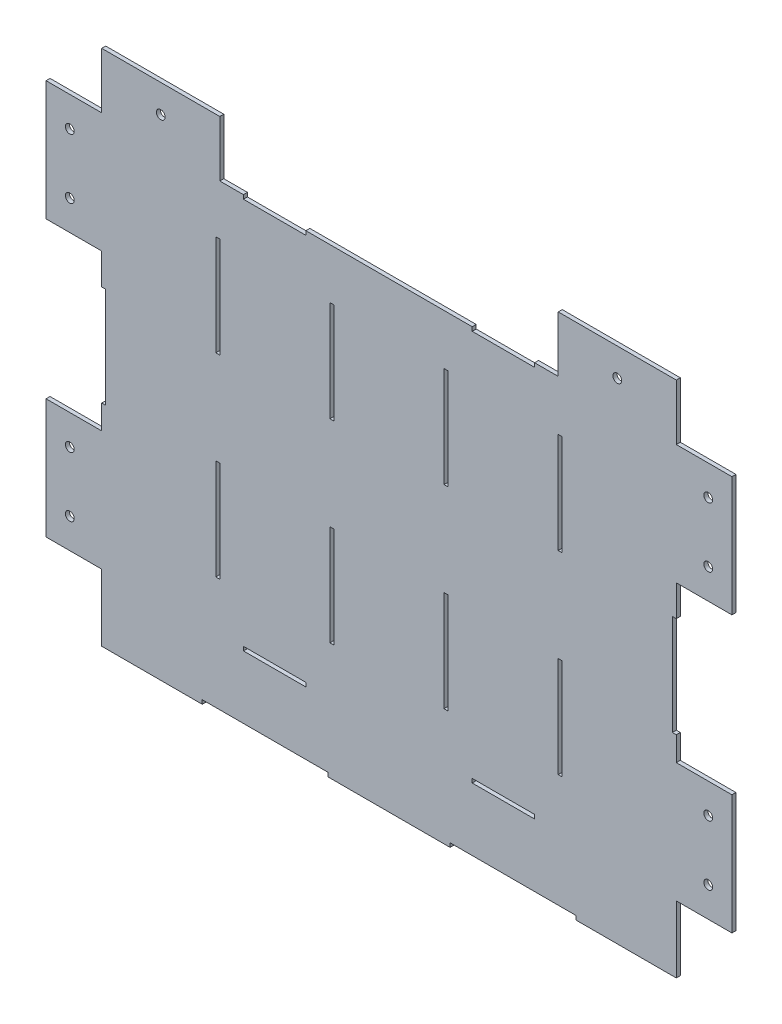
from build123d import *

# Parameters (mm, degrees)
SKETCH1_W                 = 457.223
SKETCH1_H                 = 367.60800004
BOSS_EXTRUDE2_DEPTH       = 3.175
SKETCH4_W                 = 3.175
SKETCH4_H                 = 80
CUT_EXTRUDE1_DEPTH        = 3.175
LPATTERN1_COPY_1_SKETCH_W = 3.175
LPATTERN1_COPY_1_SKETCH_H = 80
LPATTERN1_COPY_1_DEPTH    = 3.175
LPATTERN1_COPY_2_SKETCH_W = 3.175
LPATTERN1_COPY_2_SKETCH_H = 80
LPATTERN1_COPY_2_DEPTH    = 3.175
LPATTERN1_COPY_3_SKETCH_W = 3.175
LPATTERN1_COPY_3_SKETCH_H = 80
LPATTERN1_COPY_3_DEPTH    = 3.175
LPATTERN1_COPY_4_SKETCH_W = 3.175
LPATTERN1_COPY_4_SKETCH_H = 80
LPATTERN1_COPY_4_DEPTH    = 3.175
LPATTERN1_COPY_5_SKETCH_W = 3.175
LPATTERN1_COPY_5_SKETCH_H = 80
LPATTERN1_COPY_5_DEPTH    = 3.175
LPATTERN1_COPY_6_SKETCH_W = 3.175
LPATTERN1_COPY_6_SKETCH_H = 80
LPATTERN1_COPY_6_DEPTH    = 3.175
SKETCH5_W                 = 49.658811606
SKETCH5_H                 = 3.175
CUT_EXTRUDE2_DEPTH        = 3.175
MIRROR3_COPY_1_SKETCH_W   = 49.658811606
MIRROR3_COPY_1_SKETCH_H   = 3.175
MIRROR3_COPY_1_DEPTH      = 3.175
MIRROR3_COPY_2_SKETCH_W   = 49.658811606
MIRROR3_COPY_2_SKETCH_H   = 3.175
MIRROR3_COPY_2_DEPTH      = 3.175
SKETCH6_W                 = 3.175
SKETCH6_H                 = 80
CUT_EXTRUDE3_DEPTH        = 311.705796904
SKETCH7_W                 = 100
SKETCH7_H                 = 3.175
CUT_EXTRUDE4_DEPTH        = 3.175
SKETCH8_W                 = 44.275
SKETCH8_H                 = 95.25
SKETCH8_R                 = 3
SKETCH8_W_2               = 93.98
SKETCH8_H_2               = 44.45
BOSS_EXTRUDE3_DEPTH       = 3.175
M6_CLEARANCE_HOLE1_D      = 7


with BuildPart() as part:
    # Sketch1 → Boss-Extrude2 (new body)
    with BuildSketch(Plane.XY):
        with Locations((0, -26.588)):
            Rectangle(SKETCH1_W, SKETCH1_H)
    extrude(amount=BOSS_EXTRUDE2_DEPTH)

    # Sketch4 → Cut-Extrude1 (cut)
    with BuildSketch(Plane.XY.offset(3.175)):
        with Locations((-136.213, 77.21600002)):
            Rectangle(SKETCH4_W, SKETCH4_H)
    cut_extrude1 = extrude(amount=-CUT_EXTRUDE1_DEPTH, mode=Mode.SUBTRACT)

    # Mirror1: Cut-Extrude1 across plane
    add(cut_extrude1.mirror(Plane.ZX), mode=Mode.SUBTRACT)

    # LPattern1 copy 1 sketch → LPattern1 copy 1 (cut)
    with BuildSketch(Plane(origin=(90.807, 0, 3.175), x_dir=(1, 0, 0), z_dir=(0, 0, 1))):
        with Locations((-136.213, -77.21600002)):
            Rectangle(LPATTERN1_COPY_1_SKETCH_W, LPATTERN1_COPY_1_SKETCH_H)
    extrude(amount=-LPATTERN1_COPY_1_DEPTH, mode=Mode.SUBTRACT)

    # LPattern1 copy 2 sketch → LPattern1 copy 2 (cut)
    with BuildSketch(Plane(origin=(181.614, 0, 3.175), x_dir=(1, 0, 0), z_dir=(0, 0, 1))):
        with Locations((-136.213, -77.21600002)):
            Rectangle(LPATTERN1_COPY_2_SKETCH_W, LPATTERN1_COPY_2_SKETCH_H)
    extrude(amount=-LPATTERN1_COPY_2_DEPTH, mode=Mode.SUBTRACT)

    # LPattern1 copy 3 sketch → LPattern1 copy 3 (cut)
    with BuildSketch(Plane(origin=(272.421, 0, 3.175), x_dir=(1, 0, 0), z_dir=(0, 0, 1))):
        with Locations((-136.213, -77.21600002)):
            Rectangle(LPATTERN1_COPY_3_SKETCH_W, LPATTERN1_COPY_3_SKETCH_H)
    extrude(amount=-LPATTERN1_COPY_3_DEPTH, mode=Mode.SUBTRACT)

    # LPattern1 copy 4 sketch → LPattern1 copy 4 (cut)
    with BuildSketch(Plane(origin=(90.807, 0, 3.175), x_dir=(1, 0, 0), z_dir=(0, 0, 1))):
        with Locations((-136.213, 77.21600002)):
            Rectangle(LPATTERN1_COPY_4_SKETCH_W, LPATTERN1_COPY_4_SKETCH_H)
    extrude(amount=-LPATTERN1_COPY_4_DEPTH, mode=Mode.SUBTRACT)

    # LPattern1 copy 5 sketch → LPattern1 copy 5 (cut)
    with BuildSketch(Plane(origin=(181.614, 0, 3.175), x_dir=(1, 0, 0), z_dir=(0, 0, 1))):
        with Locations((-136.213, 77.21600002)):
            Rectangle(LPATTERN1_COPY_5_SKETCH_W, LPATTERN1_COPY_5_SKETCH_H)
    extrude(amount=-LPATTERN1_COPY_5_DEPTH, mode=Mode.SUBTRACT)

    # LPattern1 copy 6 sketch → LPattern1 copy 6 (cut)
    with BuildSketch(Plane(origin=(272.421, 0, 3.175), x_dir=(1, 0, 0), z_dir=(0, 0, 1))):
        with Locations((-136.213, 77.21600002)):
            Rectangle(LPATTERN1_COPY_6_SKETCH_W, LPATTERN1_COPY_6_SKETCH_H)
    extrude(amount=-LPATTERN1_COPY_6_DEPTH, mode=Mode.SUBTRACT)

    # Sketch5 → Cut-Extrude2 (cut)
    with BuildSketch(Plane.XY.offset(3.175)):
        with Locations((-91.020094169, -155.62850002)):
            Rectangle(SKETCH5_W, SKETCH5_H)
    cut_extrude2 = extrude(amount=-CUT_EXTRUDE2_DEPTH, mode=Mode.SUBTRACT)

    # Mirror2: Cut-Extrude2 across plane
    add(cut_extrude2.mirror(Plane(origin=(0, 0, 0), x_dir=(0, 0, 1), z_dir=(1, 0, 0))), mode=Mode.SUBTRACT)

    # Mirror3 copy 1 sketch → Mirror3 copy 1 (cut)
    with BuildSketch(Plane(origin=(0, 0, 3.175), x_dir=(-1, 0, 0), z_dir=(0, 0, 1))):
        with Locations((-91.020094169, -155.62850002)):
            Rectangle(MIRROR3_COPY_1_SKETCH_W, MIRROR3_COPY_1_SKETCH_H)
    extrude(amount=-MIRROR3_COPY_1_DEPTH, mode=Mode.SUBTRACT)

    # Mirror3 copy 2 sketch → Mirror3 copy 2 (cut)
    with BuildSketch(Plane.XY.offset(3.175)):
        with Locations((-91.020094169, 155.62850002)):
            Rectangle(MIRROR3_COPY_2_SKETCH_W, MIRROR3_COPY_2_SKETCH_H)
    extrude(amount=-MIRROR3_COPY_2_DEPTH, mode=Mode.SUBTRACT)

    # Sketch6 → Cut-Extrude3 (cut, through all)
    with BuildSketch(Plane.XY.offset(3.175)):
        with Locations((-227.024, -2.78399998)):
            Rectangle(SKETCH6_W, SKETCH6_H)
    cut_extrude3 = extrude(amount=-CUT_EXTRUDE3_DEPTH, mode=Mode.SUBTRACT)

    # Mirror5: Cut-Extrude3 across plane
    add(cut_extrude3.mirror(Plane(origin=(0, 0, 0), x_dir=(0, 0, 1), z_dir=(1, 0, 0))), mode=Mode.SUBTRACT)

    # Sketch7 → Cut-Extrude4 (cut)
    with BuildSketch(Plane.XY.offset(3.175)):
        with Locations((-98.6115, -208.8045)):
            Rectangle(SKETCH7_W, SKETCH7_H)
    cut_extrude4 = extrude(amount=-CUT_EXTRUDE4_DEPTH, mode=Mode.SUBTRACT)

    # Mirror6: Cut-Extrude4 across plane
    add(cut_extrude4.mirror(Plane(origin=(0, 0, 0), x_dir=(0, 0, 1), z_dir=(1, 0, 0))), mode=Mode.SUBTRACT)

    # Sketch8 → Boss-Extrude3 (add)
    # profile 1 of 3: a face of its own
    with BuildSketch(Plane(origin=(0, 0, 0), x_dir=(-1, 0, 0), z_dir=(0, 0, -1))):
        with Locations((-250.749, 109.59100002)):
            Rectangle(SKETCH8_W, SKETCH8_H)
        with Locations((-254.0115, 85.77850002)):
            Circle(SKETCH8_R, mode=Mode.SUBTRACT)
        with Locations((-254.0115, 133.40350002)):
            Circle(SKETCH8_R, mode=Mode.SUBTRACT)
    # profile 2 of 3: a face of its own
    with BuildSketch(Plane(origin=(0, 0, 0), x_dir=(-1, 0, 0), z_dir=(0, 0, -1))):
        with Locations((-181.6215, 179.44100002)):
            Rectangle(SKETCH8_W_2, SKETCH8_H_2)
        with Locations((-181.6215, 179.44100002)):
            Circle(SKETCH8_R, mode=Mode.SUBTRACT)
    # profile 3 of 3: a face of its own
    with BuildSketch(Plane(origin=(0, 0, 0), x_dir=(-1, 0, 0), z_dir=(0, 0, -1))):
        with Locations((-250.749, -109.620240426)):
            Rectangle(SKETCH8_W, SKETCH8_H)
        with Locations((-254.0115, -133.432740426)):
            Circle(SKETCH8_R, mode=Mode.SUBTRACT)
        with Locations((-254.0115, -85.807740426)):
            Circle(SKETCH8_R, mode=Mode.SUBTRACT)
    boss_extrude3 = extrude(amount=-BOSS_EXTRUDE3_DEPTH)

    # Mirror7: Boss-Extrude3 across plane
    add(boss_extrude3.mirror(Plane(origin=(0, 0, 0), x_dir=(0, 0, 1), z_dir=(1, 0, 0))))

    # M6 Clearance Hole1 (through all)
    with Locations(Plane(origin=(0, 0, 0), x_dir=(-1, 0, 0), z_dir=(0, 0, -1))):
        with Locations((-254.0115, 133.40350002), (-254.0115, 85.77850002), (-254.0115, -85.807740426), (-254.0115, -133.432740426), (-181.6215, 179.44100002), (181.6215, 179.44100002), (254.0115, 133.40350002), (254.0115, 85.77850002), (254.0115, -85.807740426), (254.0115, -133.432740426)):
            Hole(M6_CLEARANCE_HOLE1_D / 2)


solid = part.part
